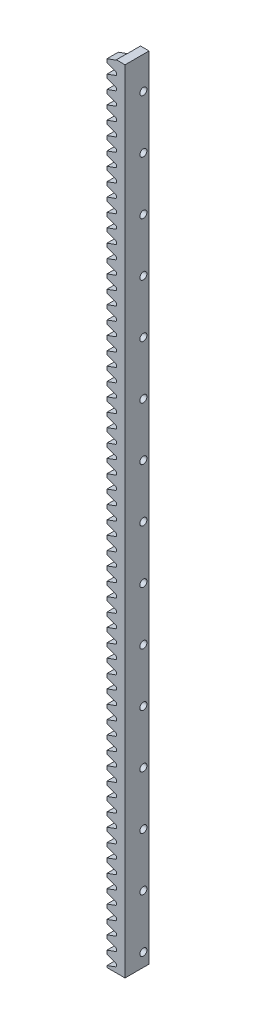
from build123d import *

# Parameters (mm, degrees)
SKETCHCI_M_STRSKETCHNAME_W = 20.549999977
SKETCHCI_M_STRSKETCHNAME_H = 329.867223673
CI_DEPTH                   = 4
CUT_EXTRUDE_471_DEPTH      = 9.525
PATTERN_LINEAR_532_COUNT   = 70
PATTERN_LINEAR_532_PITCH   = 4.71238898
SKETCH_1_W                 = 14.149999977
SKETCH_1_H                 = 329.867223673
CUT_EXTRUDE_1_DEPTH        = 329.088976894
SKETCH_2_W                 = 3.025000051
SKETCH_2_H                 = 329.867223673
EXTRUDE_1_DEPTH            = 4.5
CUT_EXTRUDE_2_REACH        = 329.559
SKETCH_3_R                 = 1.25
SKETCH_4_W                 = 8.5
SKETCH_4_H                 = 49.867223673
CUT_EXTRUDE_3_DEPTH        = 328.604463125


with BuildPart() as part:
    # SketchCI.m_strSketchName → 拉伸CI (new body)
    with BuildSketch(Plane.XY):
        with Locations((8.775000011, -162.577417382)):
            Rectangle(SKETCHCI_M_STRSKETCHNAME_W, SKETCHCI_M_STRSKETCHNAME_H)
    extrude(amount=CI_DEPTH)

    # Sketch 399 → Cut-Extrude 471 (cut, symmetric)
    with BuildSketch(Plane.XY):
        with BuildLine():
            Line((-1.499999977, 1.724052571), (-1.499999977, -1.724052571))
            Line((-1.499999977, -1.724052571), (1.578909041, -0.603421334))
            ThreePointArc((1.578909041, -0.603421334), (1.793618393, -0.438669053), (1.874999972, -0.180559661))
            Line((1.874999972, -0.180559661), (1.874999972, 0.180559661))
            ThreePointArc((1.874999972, 0.180559661), (1.793618393, 0.438669053), (1.578909041, 0.603421334))
            Line((1.578909041, 0.603421334), (-1.499999977, 1.724052571))
        make_face()
    cut_extrude_471 = extrude(amount=CUT_EXTRUDE_471_DEPTH, both=True, mode=Mode.SUBTRACT)

    # Pattern Linear 532: Cut-Extrude 471 ×70
    with Locations(*[(0, -i * PATTERN_LINEAR_532_PITCH, 0) for i in range(1, PATTERN_LINEAR_532_COUNT)]):
        add(cut_extrude_471, mode=Mode.SUBTRACT)

    # 草图1 → 切除-拉伸1 (cut, through all)
    with BuildSketch(Plane.XY.offset(4)):
        with Locations((11.975000012, -162.577417382)):
            Rectangle(SKETCH_1_W, SKETCH_1_H)
    extrude(amount=-CUT_EXTRUDE_1_DEPTH, mode=Mode.SUBTRACT)

    # 草图2 → 凸台-拉伸1 (add)
    with BuildSketch(Plane(origin=(0, 0, 0), x_dir=(-1, 0, 0), z_dir=(0, 0, -1))):
        with Locations((-3.387499998, -162.577417382)):
            Rectangle(SKETCH_2_W, SKETCH_2_H)
    extrude(amount=EXTRUDE_1_DEPTH)

    # 草图3 → 切除-拉伸2 (cut, up to next)
    with BuildSketch(Plane.ZY.offset(-1.874999972), mode=Mode.PRIVATE) as cut_extrude_2_sk1:
        with Locations((-2.5, -322.798645156)):
            Circle(SKETCH_3_R)
    cut_extrude_2_tool1 = extrude(cut_extrude_2_sk1.sketch, amount=-CUT_EXTRUDE_2_REACH, mode=Mode.PRIVATE) & part.part
    # 草图3 → 切除-拉伸2 (cut, up to next)
    with BuildSketch(Plane.ZY.offset(-1.874999972), mode=Mode.PRIVATE) as cut_extrude_2_sk2:
        with Locations((-2.5, -303.949089235)):
            Circle(SKETCH_3_R)
    cut_extrude_2_tool2 = extrude(cut_extrude_2_sk2.sketch, amount=-CUT_EXTRUDE_2_REACH, mode=Mode.PRIVATE) & part.part
    # 草图3 → 切除-拉伸2 (cut, up to next)
    with BuildSketch(Plane.ZY.offset(-1.874999972), mode=Mode.PRIVATE) as cut_extrude_2_sk3:
        with Locations((-2.5, -285.099533313)):
            Circle(SKETCH_3_R)
    cut_extrude_2_tool3 = extrude(cut_extrude_2_sk3.sketch, amount=-CUT_EXTRUDE_2_REACH, mode=Mode.PRIVATE) & part.part
    # 草图3 → 切除-拉伸2 (cut, up to next)
    with BuildSketch(Plane.ZY.offset(-1.874999972), mode=Mode.PRIVATE) as cut_extrude_2_sk4:
        with Locations((-2.5, -266.249977392)):
            Circle(SKETCH_3_R)
    cut_extrude_2_tool4 = extrude(cut_extrude_2_sk4.sketch, amount=-CUT_EXTRUDE_2_REACH, mode=Mode.PRIVATE) & part.part
    # 草图3 → 切除-拉伸2 (cut, up to next)
    with BuildSketch(Plane.ZY.offset(-1.874999972), mode=Mode.PRIVATE) as cut_extrude_2_sk5:
        with Locations((-2.5, -247.40042147)):
            Circle(SKETCH_3_R)
    cut_extrude_2_tool5 = extrude(cut_extrude_2_sk5.sketch, amount=-CUT_EXTRUDE_2_REACH, mode=Mode.PRIVATE) & part.part
    # 草图3 → 切除-拉伸2 (cut, up to next)
    with BuildSketch(Plane.ZY.offset(-1.874999972), mode=Mode.PRIVATE) as cut_extrude_2_sk6:
        with Locations((-2.5, -228.550865549)):
            Circle(SKETCH_3_R)
    cut_extrude_2_tool6 = extrude(cut_extrude_2_sk6.sketch, amount=-CUT_EXTRUDE_2_REACH, mode=Mode.PRIVATE) & part.part
    # 草图3 → 切除-拉伸2 (cut, up to next)
    with BuildSketch(Plane.ZY.offset(-1.874999972), mode=Mode.PRIVATE) as cut_extrude_2_sk7:
        with Locations((-2.5, -209.701309627)):
            Circle(SKETCH_3_R)
    cut_extrude_2_tool7 = extrude(cut_extrude_2_sk7.sketch, amount=-CUT_EXTRUDE_2_REACH, mode=Mode.PRIVATE) & part.part
    # 草图3 → 切除-拉伸2 (cut, up to next)
    with BuildSketch(Plane.ZY.offset(-1.874999972), mode=Mode.PRIVATE) as cut_extrude_2_sk8:
        with Locations((-2.5, -190.851753706)):
            Circle(SKETCH_3_R)
    cut_extrude_2_tool8 = extrude(cut_extrude_2_sk8.sketch, amount=-CUT_EXTRUDE_2_REACH, mode=Mode.PRIVATE) & part.part
    # 草图3 → 切除-拉伸2 (cut, up to next)
    with BuildSketch(Plane.ZY.offset(-1.874999972), mode=Mode.PRIVATE) as cut_extrude_2_sk9:
        with Locations((-2.5, -172.002197784)):
            Circle(SKETCH_3_R)
    cut_extrude_2_tool9 = extrude(cut_extrude_2_sk9.sketch, amount=-CUT_EXTRUDE_2_REACH, mode=Mode.PRIVATE) & part.part
    # 草图3 → 切除-拉伸2 (cut, up to next)
    with BuildSketch(Plane.ZY.offset(-1.874999972), mode=Mode.PRIVATE) as cut_extrude_2_sk10:
        with Locations((-2.5, -153.152641863)):
            Circle(SKETCH_3_R)
    cut_extrude_2_tool10 = extrude(cut_extrude_2_sk10.sketch, amount=-CUT_EXTRUDE_2_REACH, mode=Mode.PRIVATE) & part.part
    # 草图3 → 切除-拉伸2 (cut, up to next)
    with BuildSketch(Plane.ZY.offset(-1.874999972), mode=Mode.PRIVATE) as cut_extrude_2_sk11:
        with Locations((-2.5, -134.303085941)):
            Circle(SKETCH_3_R)
    cut_extrude_2_tool11 = extrude(cut_extrude_2_sk11.sketch, amount=-CUT_EXTRUDE_2_REACH, mode=Mode.PRIVATE) & part.part
    # 草图3 → 切除-拉伸2 (cut, up to next)
    with BuildSketch(Plane.ZY.offset(-1.874999972), mode=Mode.PRIVATE) as cut_extrude_2_sk12:
        with Locations((-2.5, -115.453530019)):
            Circle(SKETCH_3_R)
    cut_extrude_2_tool12 = extrude(cut_extrude_2_sk12.sketch, amount=-CUT_EXTRUDE_2_REACH, mode=Mode.PRIVATE) & part.part
    # 草图3 → 切除-拉伸2 (cut, up to next)
    with BuildSketch(Plane.ZY.offset(-1.874999972), mode=Mode.PRIVATE) as cut_extrude_2_sk13:
        with Locations((-2.5, -96.603974098)):
            Circle(SKETCH_3_R)
    cut_extrude_2_tool13 = extrude(cut_extrude_2_sk13.sketch, amount=-CUT_EXTRUDE_2_REACH, mode=Mode.PRIVATE) & part.part
    # 草图3 → 切除-拉伸2 (cut, up to next)
    with BuildSketch(Plane.ZY.offset(-1.874999972), mode=Mode.PRIVATE) as cut_extrude_2_sk14:
        with Locations((-2.5, -77.754418176)):
            Circle(SKETCH_3_R)
    cut_extrude_2_tool14 = extrude(cut_extrude_2_sk14.sketch, amount=-CUT_EXTRUDE_2_REACH, mode=Mode.PRIVATE) & part.part
    # 草图3 → 切除-拉伸2 (cut, up to next)
    with BuildSketch(Plane.ZY.offset(-1.874999972), mode=Mode.PRIVATE) as cut_extrude_2_sk15:
        with Locations((-2.5, -58.904862255)):
            Circle(SKETCH_3_R)
    cut_extrude_2_tool15 = extrude(cut_extrude_2_sk15.sketch, amount=-CUT_EXTRUDE_2_REACH, mode=Mode.PRIVATE) & part.part
    # 草图3 → 切除-拉伸2 (cut, up to next)
    with BuildSketch(Plane.ZY.offset(-1.874999972), mode=Mode.PRIVATE) as cut_extrude_2_sk16:
        with Locations((-2.5, -40.055306333)):
            Circle(SKETCH_3_R)
    cut_extrude_2_tool16 = extrude(cut_extrude_2_sk16.sketch, amount=-CUT_EXTRUDE_2_REACH, mode=Mode.PRIVATE) & part.part
    # 草图3 → 切除-拉伸2 (cut, up to next)
    with BuildSketch(Plane.ZY.offset(-1.874999972), mode=Mode.PRIVATE) as cut_extrude_2_sk17:
        with Locations((-2.5, -21.205750412)):
            Circle(SKETCH_3_R)
    cut_extrude_2_tool17 = extrude(cut_extrude_2_sk17.sketch, amount=-CUT_EXTRUDE_2_REACH, mode=Mode.PRIVATE) & part.part
    # 草图3 → 切除-拉伸2 (cut, up to next)
    with BuildSketch(Plane.ZY.offset(-1.874999972), mode=Mode.PRIVATE) as cut_extrude_2_sk18:
        with Locations((-2.5, -2.35619449)):
            Circle(SKETCH_3_R)
    cut_extrude_2_tool18 = extrude(cut_extrude_2_sk18.sketch, amount=-CUT_EXTRUDE_2_REACH, mode=Mode.PRIVATE) & part.part
    add(cut_extrude_2_tool1.solids().sort_by_distance((1.875, -322.798645, -2.5))[0], mode=Mode.SUBTRACT)
    add(cut_extrude_2_tool2.solids().sort_by_distance((1.875, -303.949089, -2.5))[0], mode=Mode.SUBTRACT)
    add(cut_extrude_2_tool3.solids().sort_by_distance((1.875, -285.099533, -2.5))[0], mode=Mode.SUBTRACT)
    add(cut_extrude_2_tool4.solids().sort_by_distance((1.875, -266.249977, -2.5))[0], mode=Mode.SUBTRACT)
    add(cut_extrude_2_tool5.solids().sort_by_distance((1.875, -247.400421, -2.5))[0], mode=Mode.SUBTRACT)
    add(cut_extrude_2_tool6.solids().sort_by_distance((1.875, -228.550866, -2.5))[0], mode=Mode.SUBTRACT)
    add(cut_extrude_2_tool7.solids().sort_by_distance((1.875, -209.70131, -2.5))[0], mode=Mode.SUBTRACT)
    add(cut_extrude_2_tool8.solids().sort_by_distance((1.875, -190.851754, -2.5))[0], mode=Mode.SUBTRACT)
    add(cut_extrude_2_tool9.solids().sort_by_distance((1.875, -172.002198, -2.5))[0], mode=Mode.SUBTRACT)
    add(cut_extrude_2_tool10.solids().sort_by_distance((1.875, -153.152642, -2.5))[0], mode=Mode.SUBTRACT)
    add(cut_extrude_2_tool11.solids().sort_by_distance((1.875, -134.303086, -2.5))[0], mode=Mode.SUBTRACT)
    add(cut_extrude_2_tool12.solids().sort_by_distance((1.875, -115.45353, -2.5))[0], mode=Mode.SUBTRACT)
    add(cut_extrude_2_tool13.solids().sort_by_distance((1.875, -96.603974, -2.5))[0], mode=Mode.SUBTRACT)
    add(cut_extrude_2_tool14.solids().sort_by_distance((1.875, -77.754418, -2.5))[0], mode=Mode.SUBTRACT)
    add(cut_extrude_2_tool15.solids().sort_by_distance((1.875, -58.904862, -2.5))[0], mode=Mode.SUBTRACT)
    add(cut_extrude_2_tool16.solids().sort_by_distance((1.875, -40.055306, -2.5))[0], mode=Mode.SUBTRACT)
    add(cut_extrude_2_tool17.solids().sort_by_distance((1.875, -21.20575, -2.5))[0], mode=Mode.SUBTRACT)
    add(cut_extrude_2_tool18.solids().sort_by_distance((1.875, -2.356194, -2.5))[0], mode=Mode.SUBTRACT)

    # 草图4 → 切除-拉伸3 (cut, through all)
    with BuildSketch(Plane(origin=(4.900000023, 0, 0), x_dir=(0, 0, -1), z_dir=(1, 0, 0))):
        with Locations((0.25, -22.577417382)):
            Rectangle(SKETCH_4_W, SKETCH_4_H)
    extrude(amount=-CUT_EXTRUDE_3_DEPTH, mode=Mode.SUBTRACT)


solid = part.part
